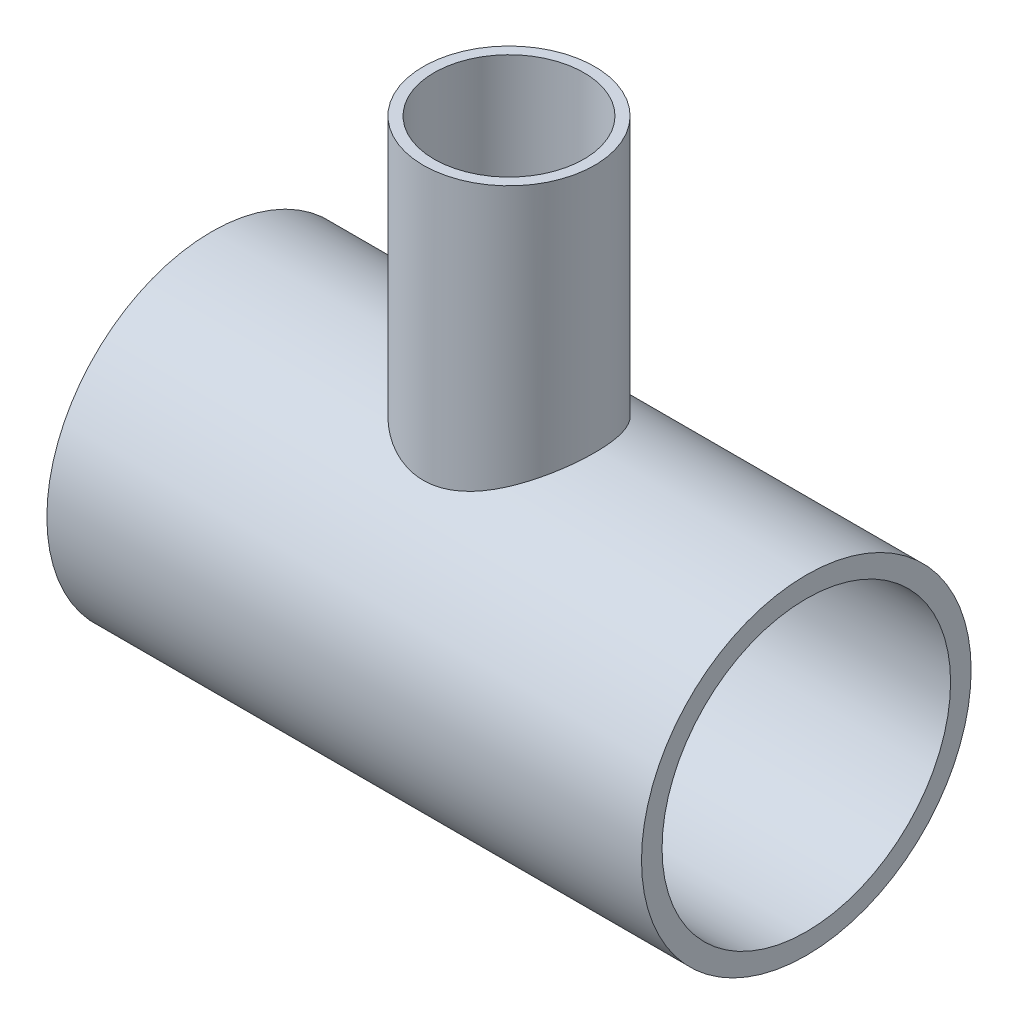
from build123d import *

# Parameters (mm, degrees)
REVOLVE_OF_12_NOM_W           = 584.2
REVOLVE_OF_12_NOM_H           = 20.193
F_6_NOM_OD_EXTRUDE_REACH      = 832.965
F_6_NOM_OD_EXTRUDE_END_RADIUS = 161.925
SKETCH2_R                     = 84.1375
F_6_NOM_ID_EXTRUDE_CUT_REACH  = 832.965
F_6_NOM_ID_EXTRUDE_R          = 73.6473


with BuildPart() as part:
    # Revolve of 12 NOM → Revolve12 NOM (revolve)
    with BuildSketch(Plane.XY):
        with Locations((292.1, 151.8285)):
            Rectangle(REVOLVE_OF_12_NOM_W, REVOLVE_OF_12_NOM_H)
    revolve(axis=Axis((0, 0, 0), (1, 0, 0)))

    # 6 NOM OD Extrude: up to this cylinder (the profile starts outside it)
    f_6_nom_od_extrude_end = Plane(origin=(292.1, 0, 0), z_dir=(-1, 0, 0)) * Cylinder(F_6_NOM_OD_EXTRUDE_END_RADIUS, 1990.78, mode=Mode.PRIVATE)
    # Sketch2 → 6 NOM OD Extrude (add, up to the surface)
    with BuildSketch(Plane(origin=(0, 406.4, 0), x_dir=(1, 0, 0), z_dir=(0, 1, 0)), mode=Mode.PRIVATE) as f_6_nom_od_extrude_sk1:
        with Locations((292.1, 0)):
            Circle(SKETCH2_R)
    f_6_nom_od_extrude_tool1 = extrude(f_6_nom_od_extrude_sk1.sketch, amount=-F_6_NOM_OD_EXTRUDE_REACH, mode=Mode.PRIVATE) - f_6_nom_od_extrude_end
    add(f_6_nom_od_extrude_tool1.solids().sort_by_distance((292.1, 406.4, 0))[0])

    # 6 NOM ID Extrude → 6 NOM ID Extrude Cut (cut, up to next)
    with BuildSketch(Plane(origin=(0, 406.4, 0), x_dir=(1, 0, 0), z_dir=(0, 1, 0)), mode=Mode.PRIVATE) as f_6_nom_id_extrude_cut_sk1:
        with Locations((292.1, 0)):
            Circle(F_6_NOM_ID_EXTRUDE_R)
    f_6_nom_id_extrude_cut_tool1 = extrude(f_6_nom_id_extrude_cut_sk1.sketch, amount=-F_6_NOM_ID_EXTRUDE_CUT_REACH, mode=Mode.PRIVATE) & part.part
    add(f_6_nom_id_extrude_cut_tool1.solids().sort_by_distance((292.1, 406.4, 0))[0], mode=Mode.SUBTRACT)


solid = part.part
